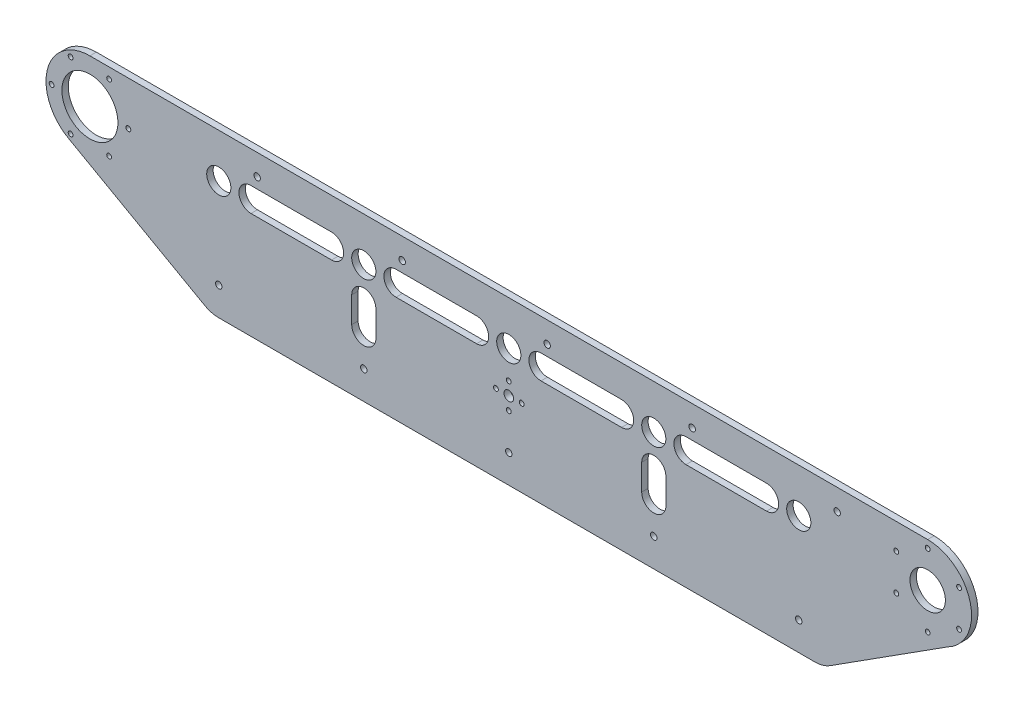
from build123d import *

# Parameters (mm, degrees)
CROQUIS1_R              = 2
CROQUIS1_R_2            = 7.5
CROQUIS1_R_3            = 17.4
CROQUIS1_R_4            = 11
CROQUIS1_R_5            = 1.5
CROQUIS1_R_6            = 3
SALIENTE_EXTRUIR1_DEPTH = 2
CROQUIS2_R              = 1.5
CORTAR_EXTRUIR1_DEPTH   = 10
CROQUIS3_R              = 1.5
CORTAR_EXTRUIR2_DEPTH   = 10
CROQUIS4_R              = 2
CORTAR_EXTRUIR3_DEPTH   = 10


with BuildPart() as part:
    # Croquis1 → Saliente-Extruir1 (new, symmetric)
    with BuildSketch(Plane.XY):
        with BuildLine():
            Line((-179.195612521, -41.480204958), (179.195612521, -41.480204958))
            Line((179.195612521, -41.480204958), (190.010789857, -41.480204958))
            ThreePointArc((190.010789857, -41.480204958), (194.944809403, -40.774865591), (199.483580997, -38.715349889))
            Line((199.483580997, -38.715349889), (272.742664287, 8.031785175))
            ThreePointArc((272.742664287, 8.031785175), (286.437106864, 38.672371901), (260, 59.347542834))
            Line((260, 59.347542834), (-260, 59.347542834))
            ThreePointArc((-260, 59.347542834), (-286.437106864, 38.672371901), (-272.742664287, 8.031785175))
            Line((-272.742664287, 8.031785175), (-188.625622076, -39.240895373))
            ThreePointArc((-188.625622076, -39.240895373), (-184.06774563, -41.022236998), (-179.195612521, -41.480204958))
        make_face()
        with Locations((0, -23.892457166)):
            Circle(CROQUIS1_R, mode=Mode.SUBTRACT)
        with Locations((-90, -23.892457166)):
            Circle(CROQUIS1_R, mode=Mode.SUBTRACT)
        with Locations((-180, -23.892457166)):
            Circle(CROQUIS1_R, mode=Mode.SUBTRACT)
        with Locations((-90, 32.107542834)):
            Circle(CROQUIS1_R_2, mode=Mode.SUBTRACT)
        with Locations((0, 32.107542834)):
            Circle(CROQUIS1_R_2, mode=Mode.SUBTRACT)
        with Locations((-260, 32.107542834)):
            Circle(CROQUIS1_R_3, mode=Mode.SUBTRACT)
        with Locations((260, 32.107542834)):
            Circle(CROQUIS1_R_4, mode=Mode.SUBTRACT)
        with Locations((90, 32.107542834)):
            Circle(CROQUIS1_R_2, mode=Mode.SUBTRACT)
        with Locations((90, -23.892457166)):
            Circle(CROQUIS1_R, mode=Mode.SUBTRACT)
        with Locations((-180, 32.107542834)):
            Circle(CROQUIS1_R_2, mode=Mode.SUBTRACT)
        with Locations((180, 32.107542834)):
            Circle(CROQUIS1_R_2, mode=Mode.SUBTRACT)
        with Locations((-8, 6.607542834)):
            Circle(CROQUIS1_R_5, mode=Mode.SUBTRACT)
        with Locations((0, 14.607542834)):
            Circle(CROQUIS1_R_5, mode=Mode.SUBTRACT)
        with Locations((8, 6.607542834)):
            Circle(CROQUIS1_R_5, mode=Mode.SUBTRACT)
        with Locations((0, -1.392457166)):
            Circle(CROQUIS1_R_5, mode=Mode.SUBTRACT)
        with Locations((0, 6.607542834)):
            Circle(CROQUIS1_R_6, mode=Mode.SUBTRACT)
        with Locations((180, -23.892457166)):
            Circle(CROQUIS1_R, mode=Mode.SUBTRACT)
        with BuildLine():
            Line((-82.5, 12.107542834), (-82.5, -3.892457166))
            ThreePointArc((-82.5, -3.892457166), (-90, -11.392457166), (-97.5, -3.892457166))
            Line((-97.5, -3.892457166), (-97.5, 12.107542834))
            ThreePointArc((-97.5, 12.107542834), (-90, 19.607542834), (-82.5, 12.107542834))
        make_face(mode=Mode.SUBTRACT)
        with BuildLine():
            Line((-20, 24.607542834), (-70, 24.607542834))
            ThreePointArc((-70, 24.607542834), (-77.5, 32.107542834), (-70, 39.607542834))
            Line((-70, 39.607542834), (-20, 39.607542834))
            ThreePointArc((-20, 39.607542834), (-12.5, 32.107542834), (-20, 24.607542834))
        make_face(mode=Mode.SUBTRACT)
        with BuildLine():
            Line((20, 39.607542834), (70, 39.607542834))
            ThreePointArc((70, 39.607542834), (77.5, 32.107542834), (70, 24.607542834))
            Line((70, 24.607542834), (20, 24.607542834))
            ThreePointArc((20, 24.607542834), (12.5, 32.107542834), (20, 39.607542834))
        make_face(mode=Mode.SUBTRACT)
        with BuildLine():
            Line((-160, 39.607542834), (-110, 39.607542834))
            ThreePointArc((-110, 39.607542834), (-102.5, 32.107542834), (-110, 24.607542834))
            Line((-110, 24.607542834), (-160, 24.607542834))
            ThreePointArc((-160, 24.607542834), (-167.5, 32.107542834), (-160, 39.607542834))
        make_face(mode=Mode.SUBTRACT)
        with BuildLine():
            Line((160, 24.607542834), (110, 24.607542834))
            ThreePointArc((110, 24.607542834), (102.5, 32.107542834), (110, 39.607542834))
            Line((110, 39.607542834), (160, 39.607542834))
            ThreePointArc((160, 39.607542834), (167.5, 32.107542834), (160, 24.607542834))
        make_face(mode=Mode.SUBTRACT)
        with BuildLine():
            Line((97.5, 12.107542834), (97.5, -3.892457166))
            ThreePointArc((97.5, -3.892457166), (90, -11.392457166), (82.5, -3.892457166))
            Line((82.5, -3.892457166), (82.5, 12.107542834))
            ThreePointArc((82.5, 12.107542834), (90, 19.607542834), (97.5, 12.107542834))
        make_face(mode=Mode.SUBTRACT)
    extrude(amount=SALIENTE_EXTRUIR1_DEPTH, both=True)

    # Croquis2 → Cortar-Extruir1 (cut)
    with BuildSketch(Plane.XY.offset(2)):
        with Locations((-283.74, 32.107542834)):
            Circle(CROQUIS2_R)
        with Locations((-271.95, 52.805549985)):
            Circle(CROQUIS2_R)
        with Locations((-248.05, 52.805549985)):
            Circle(CROQUIS2_R)
        with Locations((-236.1, 32.107542834)):
            Circle(CROQUIS2_R)
        with Locations((-248.05, 11.409535684)):
            Circle(CROQUIS2_R)
        with Locations((-271.95, 11.409535684)):
            Circle(CROQUIS2_R)
    extrude(amount=-CORTAR_EXTRUIR1_DEPTH, mode=Mode.SUBTRACT)

    # Croquis3 → Cortar-Extruir2 (cut)
    with BuildSketch(Plane.XY.offset(2)):
        with Locations((260, 54.607542834)):
            Circle(CROQUIS3_R)
        with Locations((279.485571585, 43.357542834)):
            Circle(CROQUIS3_R)
        with Locations((279.485571585, 20.857542834)):
            Circle(CROQUIS3_R)
        with Locations((260, 9.607542834)):
            Circle(CROQUIS3_R)
        with Locations((240.514428415, 20.857542834)):
            Circle(CROQUIS3_R)
        with Locations((240.514428415, 43.357542834)):
            Circle(CROQUIS3_R)
    extrude(amount=-CORTAR_EXTRUIR2_DEPTH, mode=Mode.SUBTRACT)

    # Croquis4 → Cortar-Extruir3 (cut)
    with BuildSketch(Plane.XY.offset(2)):
        with Locations((-156.165571585, 46.217542834)):
            Circle(CROQUIS4_R)
        with Locations((-66.165571585, 46.217542834)):
            Circle(CROQUIS4_R)
        with Locations((23.834428415, 46.217542834)):
            Circle(CROQUIS4_R)
        with Locations((113.834428415, 46.217542834)):
            Circle(CROQUIS4_R)
        with Locations((203.834428415, 46.217542834)):
            Circle(CROQUIS4_R)
    extrude(amount=-CORTAR_EXTRUIR3_DEPTH, mode=Mode.SUBTRACT)


solid = part.part
